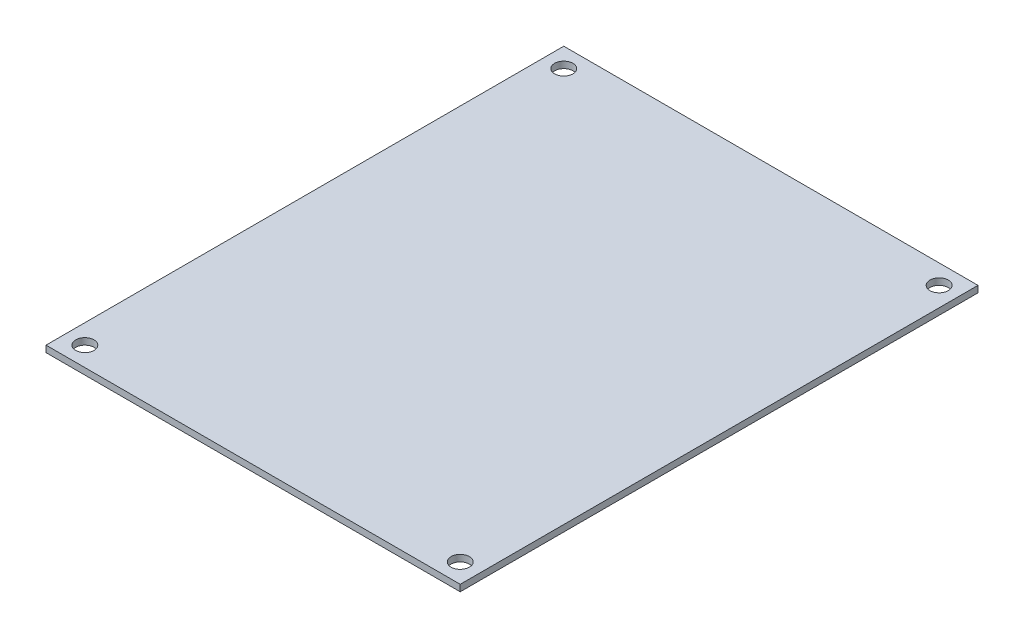
from build123d import *

# Parameters (mm, degrees)
SKETCH1_W                = 101.6
SKETCH1_H                = 127
BOSS_EXTRUDE1_DEPTH      = 1.6
M4_CLEARANCE_HOLE1_D     = 4.5
M4_CLEARANCE_HOLE1_DEPTH = 50
M4_CLEARANCE_HOLE1_TIP   = 1.351936393


with BuildPart() as part:
    # Sketch1 → Boss-Extrude1 (new body)
    with BuildSketch(Plane(origin=(0, 0, 0), x_dir=(1, 0, 0), z_dir=(0, 1, 0))):
        Rectangle(SKETCH1_W, SKETCH1_H)
    extrude(amount=BOSS_EXTRUDE1_DEPTH)

    # M4 Clearance Hole1
    with Locations(Plane(origin=(0, 1.6, 0), x_dir=(1, 0, 0), z_dir=(0, 1, 0))):
        with Locations((-46.0375, 58.7375), (46.0375, 58.7375), (46.0375, -58.7375), (-46.0375, -58.7375)):
            Hole(M4_CLEARANCE_HOLE1_D / 2, depth=M4_CLEARANCE_HOLE1_DEPTH)
            with Locations((0, 0, -(M4_CLEARANCE_HOLE1_DEPTH + M4_CLEARANCE_HOLE1_TIP / 2))):  # 118° drill point
                Cone(0, M4_CLEARANCE_HOLE1_D / 2, M4_CLEARANCE_HOLE1_TIP, mode=Mode.SUBTRACT)


solid = part.part
